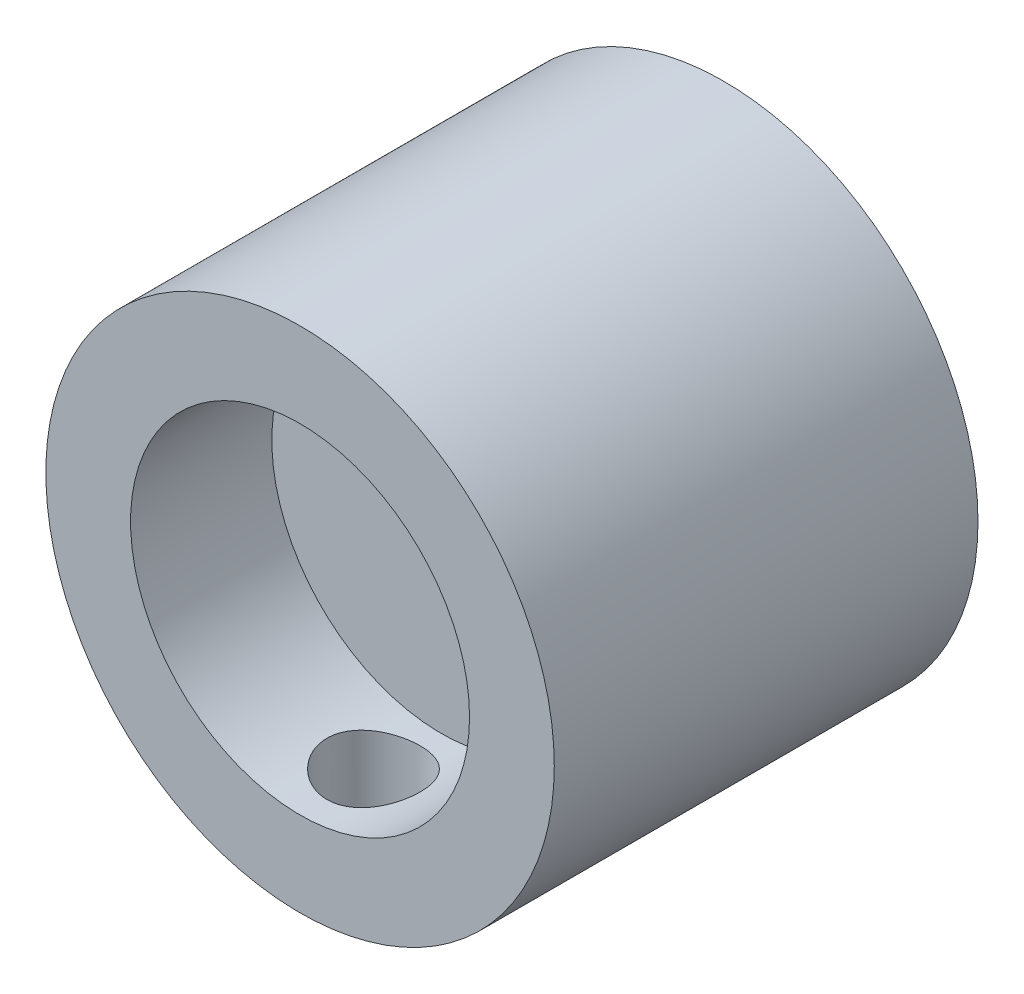
from build123d import *

# Parameters (mm, degrees)
SKETCH3_R           = 4.5
BOSS_EXTRUDE3_DEPTH = 7.5
SKETCH4_R           = 3
CUT_EXTRUDE1_DEPTH  = 2.5
SKETCH5_R           = 2
CUT_EXTRUDE2_DEPTH  = 1.9
CUT_EXTRUDE3_REACH  = 11.836
SKETCH7_R           = 0.825


with BuildPart() as part:
    # Sketch3 → Boss-Extrude3 (new body)
    with BuildSketch(Plane.XY):
        Circle(SKETCH3_R)
    extrude(amount=BOSS_EXTRUDE3_DEPTH)

    # Sketch4 → Cut-Extrude1 (cut)
    with BuildSketch(Plane.XY.offset(7.5)):
        Circle(SKETCH4_R)
    extrude(amount=-CUT_EXTRUDE1_DEPTH, mode=Mode.SUBTRACT)

    # Sketch5 → Cut-Extrude2 (cut)
    with BuildSketch(Plane(origin=(0, 0, 0), x_dir=(-1, 0, 0), z_dir=(0, 0, -1))):
        Circle(SKETCH5_R)
    extrude(amount=-CUT_EXTRUDE2_DEPTH, mode=Mode.SUBTRACT)

    # Sketch7 → Cut-Extrude3 (cut, up to next)
    with BuildSketch(Plane(origin=(0, 0, 0), x_dir=(1, 0, 0), z_dir=(0, 1, 0)), mode=Mode.PRIVATE) as cut_extrude3_sk1:
        with Locations((0, -6.2)):
            Circle(SKETCH7_R)
    cut_extrude3_tool1 = extrude(cut_extrude3_sk1.sketch, amount=-CUT_EXTRUDE3_REACH, mode=Mode.PRIVATE) & part.part
    add(cut_extrude3_tool1.solids().sort_by_distance((0, 0, 6.2))[0], mode=Mode.SUBTRACT)


solid = part.part
